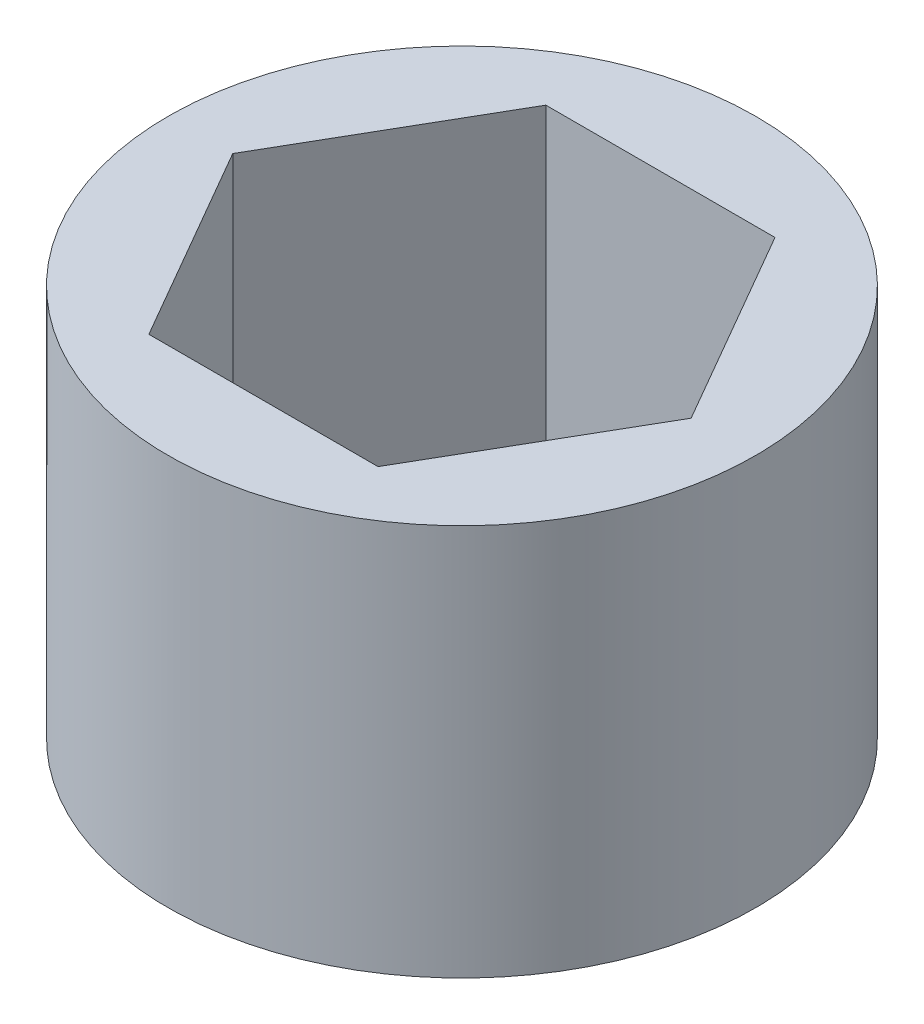
from build123d import *

# Parameters (mm, degrees)
SKETCH1_R           = 7.14375
BOSS_EXTRUDE1_DEPTH = 4.7625


with BuildPart() as part:
    # Sketch1 → Boss-Extrude1 (new, symmetric)
    with BuildSketch(Plane(origin=(0, 0, 0), x_dir=(1, 0, 0), z_dir=(0, 1, 0))):
        Circle(SKETCH1_R)
        Polygon((2.786292399, -4.826), (5.572584798, 0), (2.786292399, 4.826), (-2.786292399, 4.826), (-5.572584798, 0), (-2.786292399, -4.826), align=None, mode=Mode.SUBTRACT)
    extrude(amount=BOSS_EXTRUDE1_DEPTH, both=True)


solid = part.part
